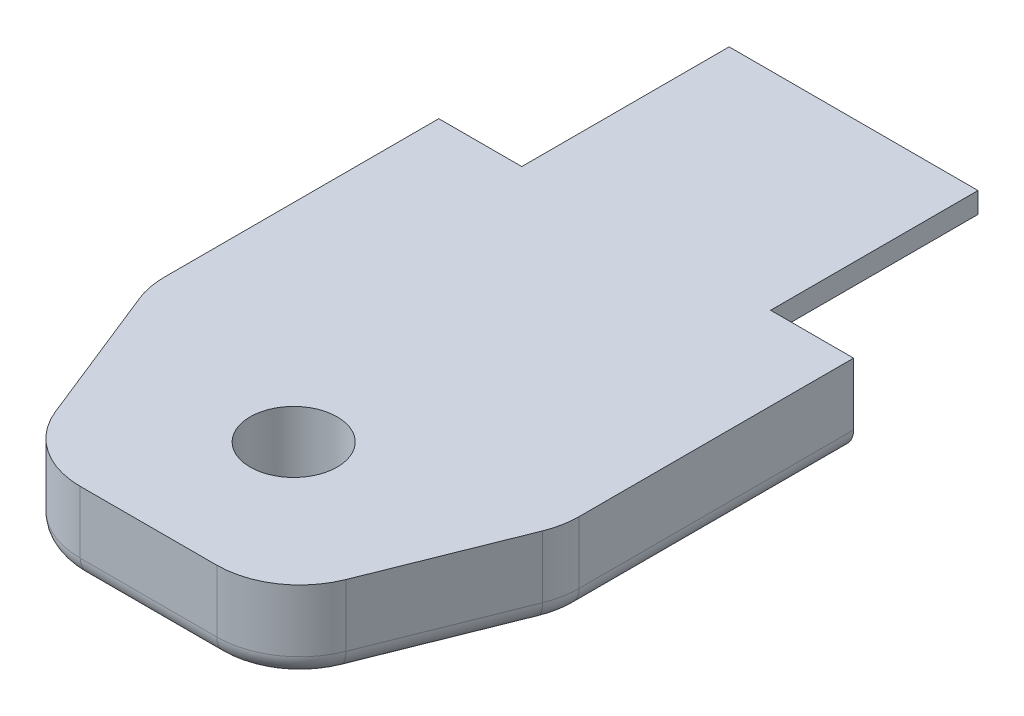
from build123d import *
from OCP.BRepFilletAPI import BRepFilletAPI_MakeChamfer

# Parameters (mm, degrees)
BOSS_EXTRU_1_DEPTH      = 10
ESQUISSE2_W             = 20
ESQUISSE2_H             = 4
BOSS_EXTRU_2_DEPTH      = 24
ESQUISSE3_R             = 2.1
ENL_V_MAT_EXTRU_1_DEPTH = 36.665109
CHANFREIN1_SIZE         = 10
CHANFREIN1_SIZE2        = 4
CONG_1_R                = 4
CONG_2_R                = 1


with BuildPart() as part:
    # Esquisse1 → Boss.-Extru.1 (new body)
    with BuildSketch(Plane.XY):
        Polygon((-3, 0), (3, 0), (6, 3), (6, 4), (-6, 4), (-6, 3), align=None)
    extrude(amount=BOSS_EXTRU_1_DEPTH)

    # Esquisse2 → Boss.-Extru.2 (add)
    with BuildSketch(Plane.XY.offset(10)):
        with Locations((0, 2)):
            Rectangle(ESQUISSE2_W, ESQUISSE2_H)
    extrude(amount=BOSS_EXTRU_2_DEPTH)

    # Esquisse3 → Enlèv. mat.-Extru.1 (cut, through all)
    with BuildSketch(Plane.XZ):
        with Locations((0, 27)):
            Circle(ESQUISSE3_R)
    extrude(amount=-ENL_V_MAT_EXTRU_1_DEPTH, mode=Mode.SUBTRACT)

    # Chanfrein1: one chamfer whose edges measure the first distance from different faces: ONE call of the kernel's chamfer builder (chamfer() names one face for all edges)
    chanfrein1_edges_1 = [part.edges().sort_by_distance(p)[0] for p in [
        (10, 2, 34),
    ]]
    chanfrein1_side_1 = [part.faces().sort_by_distance(p)[0] for p in [
        (10, 2, 22),
    ]]
    chanfrein1_edges_2 = [part.edges().sort_by_distance(p)[0] for p in [
        (-10, 2, 34),
    ]]
    chanfrein1_side_2 = [part.faces().sort_by_distance(p)[0] for p in [
        (-10, 2, 22),
    ]]
    chanfrein1 = BRepFilletAPI_MakeChamfer(part.part.solid().wrapped)
    for e in chanfrein1_edges_1:
        chanfrein1.Add(CHANFREIN1_SIZE, CHANFREIN1_SIZE2, e.wrapped, chanfrein1_side_1[0].wrapped)  # the first distance lies on this face
    for e in chanfrein1_edges_2:
        chanfrein1.Add(CHANFREIN1_SIZE, CHANFREIN1_SIZE2, e.wrapped, chanfrein1_side_2[0].wrapped)  # the first distance lies on this face
    add(Compound.cast(chanfrein1.Shape()), mode=Mode.REPLACE)

    # Congé1
    cong_1_edges = [part.edges().sort_by_distance(p)[0] for p in [
        (-10, 2, 24),
        (-6, 2, 34),
        (10, 2, 24),
        (6, 2, 34),
    ]]
    fillet(cong_1_edges, radius=CONG_1_R)

    # Congé2
    cong_2_edges = [part.edges().sort_by_distance(p)[0] for p in [
        (10, 0, 16.614835193),
        (9.927825547, 0, 23.98610047),
        (8.359840841, 0, 28.100397898),
        (5.534383392, 0, 33.312268922),
        (0, 0, 34),
        (-5.534383392, 0, 33.312268922),
        (-8.359840841, 0, 28.100397898),
        (-9.927825547, 0, 23.98610047),
        (-10, 0, 16.614835193),
    ]]
    fillet(cong_2_edges, radius=CONG_2_R)


solid = part.part
